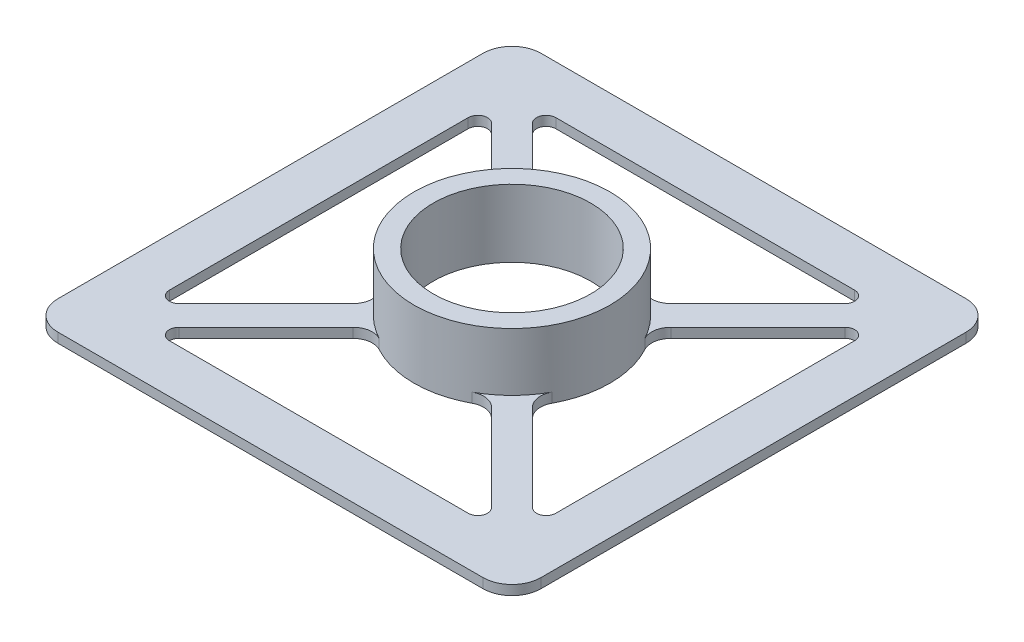
from build123d import *

# Parameters (mm, degrees)
SKETCH1_W           = 50
SKETCH1_H           = 50
SKETCH1_R           = 8.15
BASE_FLANGE1_DEPTH  = 1
FILLET1_R           = 3
FILLET2_R           = 1
FILLET3_R           = 2
BOSS_EXTRUDE1_START = 6
SKETCH2_R           = 10.15
SKETCH2_R_2         = 8.15
BOSS_EXTRUDE1_DEPTH = 6


# Sheet-metal steps are written as plain solids
with BuildPart() as part:
    # Sketch1 → Base-Flange1 (new body)
    with BuildSketch(Plane(origin=(0, 0, 0), x_dir=(1, 0, 0), z_dir=(0, 1, 0))):
        Rectangle(SKETCH1_W, SKETCH1_H)
        with Locations(Location((0, 0, 0), (0, 0, 270))):
            Circle(SKETCH1_R, mode=Mode.SUBTRACT)
        with BuildLine():
            Line((20, 17.878679656), (20, -17.878679656))
            Line((20, -17.878679656), (8.15898744, -6.037667096))
            ThreePointArc((8.15898744, -6.037667096), (10.15, 0), (8.15898744, 6.037667096))
            Line((8.15898744, 6.037667096), (20, 17.878679656))
        make_face(mode=Mode.SUBTRACT)
        with BuildLine():
            Line((17.878679656, -20), (-17.878679656, -20))
            Line((-17.878679656, -20), (-6.037667096, -8.15898744))
            ThreePointArc((-6.037667096, -8.15898744), (0, -10.15), (6.037667096, -8.15898744))
            Line((6.037667096, -8.15898744), (17.878679656, -20))
        make_face(mode=Mode.SUBTRACT)
        with BuildLine():
            Line((-20, -17.878679656), (-20, 17.878679656))
            Line((-20, 17.878679656), (-8.15898744, 6.037667096))
            ThreePointArc((-8.15898744, 6.037667096), (-10.15, 0), (-8.15898744, -6.037667096))
            Line((-8.15898744, -6.037667096), (-20, -17.878679656))
        make_face(mode=Mode.SUBTRACT)
        with BuildLine():
            Line((-17.878679656, 20), (17.878679656, 20))
            Line((17.878679656, 20), (6.037667096, 8.15898744))
            ThreePointArc((6.037667096, 8.15898744), (0, 10.15), (-6.037667096, 8.15898744))
            Line((-6.037667096, 8.15898744), (-17.878679656, 20))
        make_face(mode=Mode.SUBTRACT)
    extrude(amount=-BASE_FLANGE1_DEPTH)

    # Fillet1
    fillet1_edges = [part.edges().sort_by_distance(p)[0] for p in [
        (25, -0.5, 25),
        (-25, -0.5, 25),
        (-25, -0.5, -25),
        (25, -0.5, -25),
    ]]
    fillet(fillet1_edges, radius=FILLET1_R)

    # Fillet2
    fillet2_edges = [part.edges().sort_by_distance(p)[0] for p in [
        (17.878679656, -0.5, 20),
        (-17.878679656, -0.5, 20),
        (20, -0.5, -17.878679656),
        (20, -0.5, 17.878679656),
        (17.878679656, -0.5, -20),
        (-17.878679656, -0.5, -20),
        (-20, -0.5, -17.878679656),
        (-20, -0.5, 17.878679656),
    ]]
    fillet(fillet2_edges, radius=FILLET2_R)

    # Fillet3
    fillet3_edges = [part.edges().sort_by_distance(p)[0] for p in [
        (-6.037667096, -0.5, 8.15898744),
        (6.037667096, -0.5, 8.15898744),
        (8.15898744, -0.5, -6.037667096),
        (8.15898744, -0.5, 6.037667096),
        (6.037667096, -0.5, -8.15898744),
        (-6.037667096, -0.5, -8.15898744),
        (-8.15898744, -0.5, -6.037667096),
        (-8.15898744, -0.5, 6.037667096),
    ]]
    fillet(fillet3_edges, radius=FILLET3_R)

    # Sketch2 → Boss-Extrude1 (add)
    with BuildSketch(Plane(origin=(0, 0, 0), x_dir=(1, 0, 0), z_dir=(0, 1, 0)).offset(BOSS_EXTRUDE1_START)):
        with Locations(Location((0, 0, 0), (0, 0, 270))):
            Circle(SKETCH2_R)
        with Locations(Location((0, 0, 0), (0, 0, 270))):
            Circle(SKETCH2_R_2, mode=Mode.SUBTRACT)
    extrude(amount=-BOSS_EXTRUDE1_DEPTH)


solid = part.part
